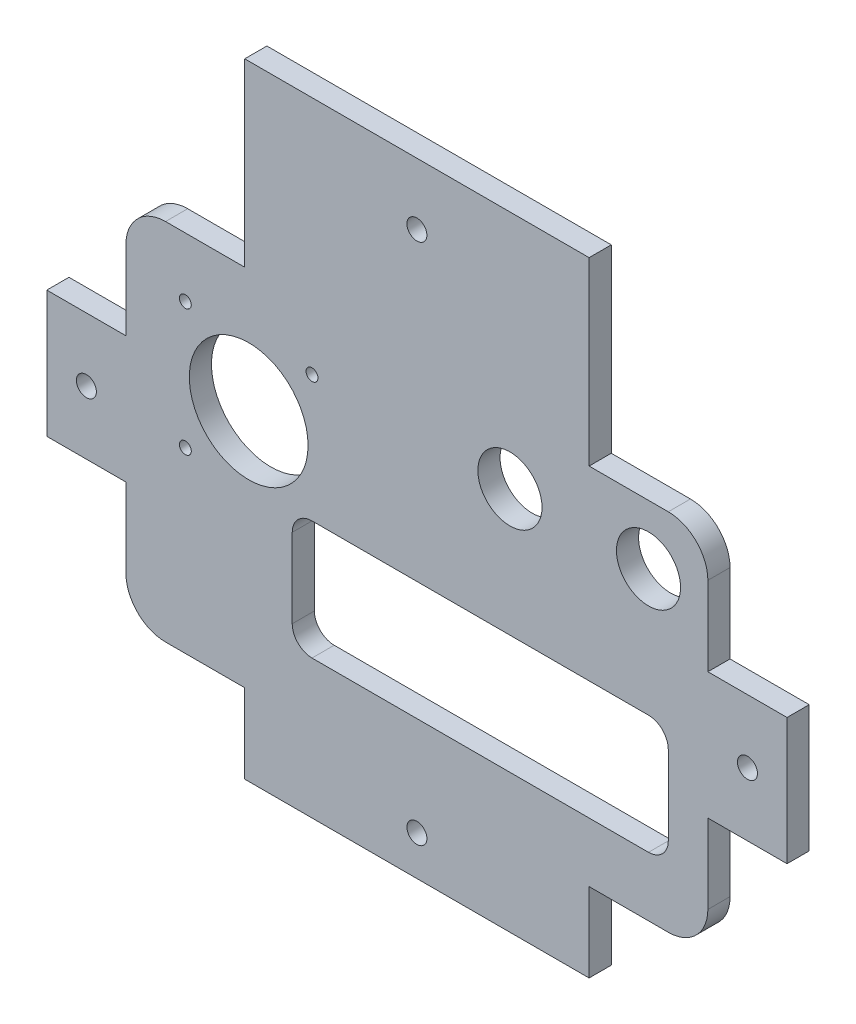
from build123d import *

# Parameters (mm, degrees)
MODEL_R             = 8.1
MODEL_R_2           = 1.5
MODEL_R_3           = 2.525
MODEL_R_4           = 15
BOSS_EXTRUDE1_DEPTH = 5.6


with BuildPart() as part:
    # Model → Boss-Extrude1 (new body)
    with BuildSketch(Plane.XY):
        with BuildLine():
            Line((-98.888270171, -14.211878362), (-78.888270171, -14.211878362))
            Line((-78.888270171, -14.211878362), (-78.888270171, -34.211878362))
            ThreePointArc((-78.888270171, -34.211878362), (-75.959337983, -41.282946174), (-68.888270171, -44.211878362))
            Line((-68.888270171, -44.211878362), (-48.888270171, -44.211878362))
            Line((-48.888270171, -44.211878362), (-48.888270171, -64.211878362))
            Line((-48.888270171, -64.211878362), (38.111729829, -64.211878362))
            Line((38.111729829, -64.211878362), (38.111729829, -44.211878362))
            Line((38.111729829, -44.211878362), (58.111729829, -44.211878362))
            ThreePointArc((58.111729829, -44.211878362), (65.182797641, -41.282946174), (68.111729829, -34.211878362))
            Line((68.111729829, -34.211878362), (68.111729829, -14.211878362))
            Line((68.111729829, -14.211878362), (88.111729829, -14.211878362))
            Line((88.111729829, -14.211878362), (88.111729829, 17.788121638))
            Line((88.111729829, 17.788121638), (68.111729829, 17.788121638))
            Line((68.111729829, 17.788121638), (68.111729829, 37.788121638))
            ThreePointArc((68.111729829, 37.788121638), (65.182797641, 44.85918945), (58.111729829, 47.788121638))
            Line((58.111729829, 47.788121638), (38.111729829, 47.788121638))
            Line((38.111729829, 47.788121638), (38.111729829, 93.388121638))
            Line((38.111729829, 93.388121638), (-48.888270171, 93.388121638))
            Line((-48.888270171, 93.388121638), (-48.888270171, 47.788121638))
            Line((-48.888270171, 47.788121638), (-68.888270171, 47.788121638))
            ThreePointArc((-68.888270171, 47.788121638), (-75.959337983, 44.85918945), (-78.888270171, 37.788121638))
            Line((-78.888270171, 37.788121638), (-78.888270171, 17.788121638))
            Line((-78.888270171, 17.788121638), (-98.888270171, 17.788121638))
            Line((-98.888270171, 17.788121638), (-98.888270171, -14.211878362))
        make_face()
        with Locations((18.111729829, 32.788121638)):
            Circle(MODEL_R, mode=Mode.SUBTRACT)
        with Locations((-31.888270171, 32.788121638)):
            Circle(MODEL_R_2, mode=Mode.SUBTRACT)
        with Locations((-63.888270171, 32.788121638)):
            Circle(MODEL_R_2, mode=Mode.SUBTRACT)
        with Locations((78.111729829, 1.788121638)):
            Circle(MODEL_R_3, mode=Mode.SUBTRACT)
        with Locations((-5.388270171, 77.788121638)):
            Circle(MODEL_R_3, mode=Mode.SUBTRACT)
        with Locations((-88.888270171, 1.788121638)):
            Circle(MODEL_R_3, mode=Mode.SUBTRACT)
        with Locations((-5.388270171, -54.211878362)):
            Circle(MODEL_R_3, mode=Mode.SUBTRACT)
        with Locations((-63.888270171, 0.788121638)):
            Circle(MODEL_R_2, mode=Mode.SUBTRACT)
        with Locations((53.111729829, 32.788121638)):
            Circle(MODEL_R, mode=Mode.SUBTRACT)
        with Locations((-47.888270171, 16.788121638)):
            Circle(MODEL_R_4, mode=Mode.SUBTRACT)
        with BuildLine():
            Line((53.111729829, 0.788121638), (-31.888270171, 0.788121638))
            ThreePointArc((-31.888270171, 0.788121638), (-35.423804077, -0.676344456), (-36.888270171, -4.211878362))
            Line((-36.888270171, -4.211878362), (-36.888270171, -24.211878362))
            ThreePointArc((-36.888270171, -24.211878362), (-35.423804077, -27.747412268), (-31.888270171, -29.211878362))
            Line((-31.888270171, -29.211878362), (53.111729829, -29.211878362))
            ThreePointArc((53.111729829, -29.211878362), (56.647263735, -27.747412268), (58.111729829, -24.211878362))
            Line((58.111729829, -24.211878362), (58.111729829, -4.211878362))
            ThreePointArc((58.111729829, -4.211878362), (56.647263735, -0.676344456), (53.111729829, 0.788121638))
        make_face(mode=Mode.SUBTRACT)
    extrude(amount=BOSS_EXTRUDE1_DEPTH)


solid = part.part
